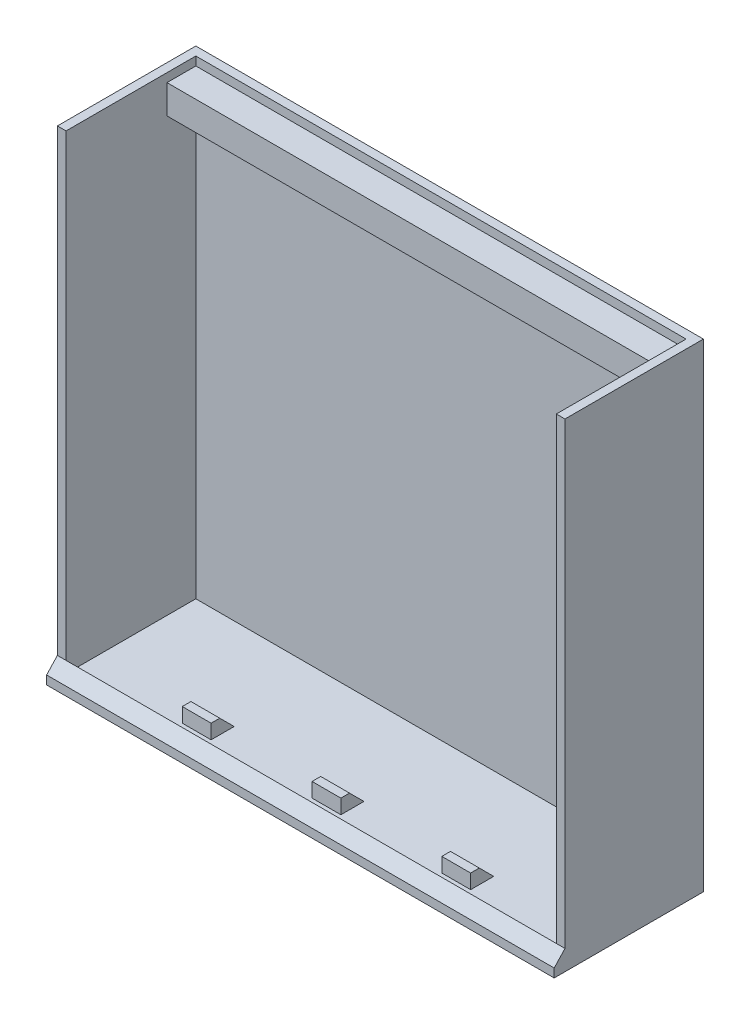
from build123d import *

# Parameters (mm, degrees)
BOSS_EXTRUDE1_DEPTH             = 85
BOSS_EXTRUDE1_DEPTH_BACK        = 85
BOSS_EXTRUDE2_START             = -85
SKETCH1_4_W                     = 45
SKETCH1_4_H                     = 163
BOSS_EXTRUDE2_DEPTH             = 3
BOSS_EXTRUDE3_START             = 85
SKETCH1_5_W                     = 45
SKETCH1_5_H                     = 163
BOSS_EXTRUDE3_DEPTH             = 3
BOSS_EXTRUDE4_REACH             = 192.625
BOSS_EXTRUDE4_DIRECTION_2_REACH = 192.625
SKETCH5_W                       = 10
SKETCH5_H                       = 3
BOSS_EXTRUDE7_DEPTH             = 5
BOSS_EXTRUDE8_DEPTH             = 88
BOSS_EXTRUDE8_DEPTH_BACK        = 88
CHAMFER1_SIZE                   = 5


with BuildPart() as part:
    # Sketch1 → Boss-Extrude1 (new, two sides: drawn at the far end of the back side and taken through both)
    with BuildSketch(Plane(origin=(0, 0, 0), x_dir=(0, 0, -1), z_dir=(1, 0, 0)).offset(-BOSS_EXTRUDE1_DEPTH_BACK)):
        Polygon((-45, -3), (-45, 0), (0, 0), (0, 163), (3, 163), (3, -3), align=None)
    extrude(amount=BOSS_EXTRUDE1_DEPTH + BOSS_EXTRUDE1_DEPTH_BACK)

    # Sketch1<4> → Boss-Extrude2 (add)
    with BuildSketch(Plane(origin=(0, 0, 0), x_dir=(0, 0, -1), z_dir=(1, 0, 0)).offset(BOSS_EXTRUDE2_START)):
        with Locations((-22.5, 81.5)):
            Rectangle(SKETCH1_4_W, SKETCH1_4_H)
        Polygon((-45, -3), (-45, 0), (0, 0), (0, 163), (3, 163), (3, -3), align=None)
    extrude(amount=-BOSS_EXTRUDE2_DEPTH)

    # Sketch1<5> → Boss-Extrude3 (add)
    with BuildSketch(Plane(origin=(0, 0, 0), x_dir=(0, 0, -1), z_dir=(1, 0, 0)).offset(BOSS_EXTRUDE3_START)):
        Polygon((-45, -3), (-45, 0), (0, 0), (0, 163), (3, 163), (3, -3), align=None)
        with Locations((-22.5, 81.5)):
            Rectangle(SKETCH1_5_W, SKETCH1_5_H)
    extrude(amount=BOSS_EXTRUDE3_DEPTH)

    # Sketch2 → Boss-Extrude4 (add, up to next)
    with BuildSketch(Plane(origin=(0, 0, 0), x_dir=(0, 0, -1), z_dir=(1, 0, 0)), mode=Mode.PRIVATE) as boss_extrude4_sk1:
        Polygon((-10, 160), (-10, 150), (0, 140), (0, 160), align=None)
    boss_extrude4_tool1 = extrude(boss_extrude4_sk1.sketch, amount=BOSS_EXTRUDE4_REACH, mode=Mode.PRIVATE) - part.part
    add(boss_extrude4_tool1.solids().sort_by_distance((0, 152.222222, 4.444444))[0])

    # Sketch2 → Boss-Extrude4 direction 2 (add, up to next)
    with BuildSketch(Plane(origin=(0, 0, 0), x_dir=(0, 0, -1), z_dir=(1, 0, 0)), mode=Mode.PRIVATE) as boss_extrude4_direction_2_sk1:
        Polygon((-10, 160), (-10, 150), (0, 140), (0, 160), align=None)
    boss_extrude4_direction_2_tool1 = extrude(boss_extrude4_direction_2_sk1.sketch, amount=-BOSS_EXTRUDE4_DIRECTION_2_REACH, mode=Mode.PRIVATE) - part.part
    add(boss_extrude4_direction_2_tool1.solids().sort_by_distance((0, 152.222222, 4.444444))[0])

    # Sketch5 → Boss-Extrude7 (add)
    with BuildSketch(Plane(origin=(0, 0, 0), x_dir=(1, 0, 0), z_dir=(0, 1, 0))):
        with Locations((-45, -38.2)):
            Rectangle(SKETCH5_W, SKETCH5_H)
        with Locations((45, -38.2)):
            Rectangle(SKETCH5_W, SKETCH5_H)
        with Locations((0, -38.2)):
            Rectangle(SKETCH5_W, SKETCH5_H)
    extrude(amount=BOSS_EXTRUDE7_DEPTH)

    # Sketch4 → Boss-Extrude8 (add, two sides: drawn at the far end of the back side and taken through both)
    with BuildSketch(Plane(origin=(0, 0, 0), x_dir=(0, 0, -1), z_dir=(1, 0, 0)).offset(-BOSS_EXTRUDE8_DEPTH_BACK)):
        Polygon((-45, -3), (-48.742573267, -3), (-48.742573267, 0), (-45, 4), (-45, 0), align=None)
    extrude(amount=BOSS_EXTRUDE8_DEPTH + BOSS_EXTRUDE8_DEPTH_BACK)

    # Chamfer1
    chamfer1_edges = [part.edges().sort_by_distance(p)[0] for p in [
        (0, 0, 36.7),
        (45, 0, 36.7),
        (-45, 0, 36.7),
    ]]
    chamfer(chamfer1_edges, length=CHAMFER1_SIZE - 0.0001)  # a hair under: the kernel refuses the full size


solid = part.part
